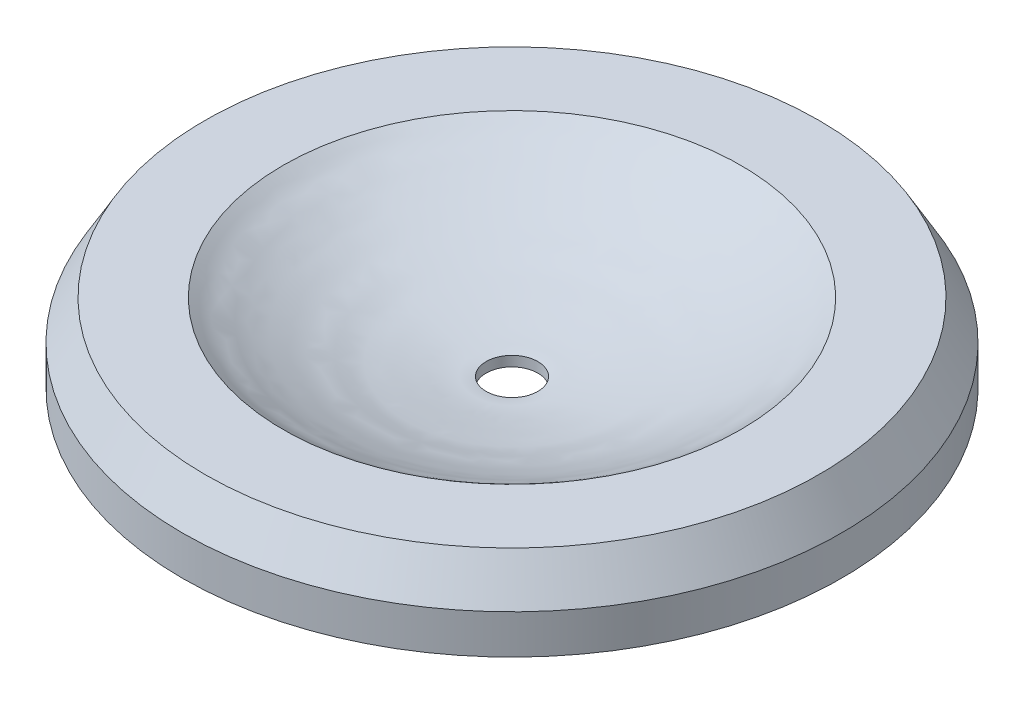
from build123d import *

# Parameters (mm, degrees)
SKETCH1_R           = 42
BOSS_EXTRUDE1_DEPTH = 10
CAVITY1_OUTLINE_W   = 3.296807109
CAVITY1_OUTLINE_H   = 8.722003862
SKETCH2_R           = 3.296807109
CUT_EXTRUDE1_DEPTH  = 61.033934998
CHAMFER1_SIZE       = 5
CHAMFER1_SIZE2      = 2.886751346


# Read off the part's stored shape, not the designer's step: Cavity1
with BuildPart() as part:
    # Sketch1 → Boss-Extrude1 (new body)
    with BuildSketch(Plane(origin=(0, 0, 0), x_dir=(1, 0, 0), z_dir=(0, 1, 0))):
        with Locations(Location((0, 0, 0), (0, 0, 270))):
            Circle(SKETCH1_R)
    extrude(amount=BOSS_EXTRUDE1_DEPTH)

    # Cavity1 outline → Cavity1 (revolve, cut)
    with BuildSketch(Plane.XY):
        with BuildLine():
            Line((3.296807109, 10.0000001), (3.296807109, 1.277996238))
            add(Edge.make_bspline(
                [(3.296807109, 1.277996238), (4.197169621, 1.438365635), (5.69903079, 1.462039555), (7.693496911, 1.848305194), (9.272215478, 2.121674562), (10.750690756, 2.424226191), (12.181632664, 2.720278367), (13.637151846, 2.964975868), (14.864343001, 3.366330129), (15.911496119, 3.711763684), (16.810008215, 4.028877941), (17.733867067, 4.263051977), (18.837916963, 4.636362632), (19.930975123, 5.084503164), (21.068588771, 5.583149701), (22.140955467, 6.015297), (23.215588995, 6.59235717), (24.437095613, 7.161677421), (25.676203543, 7.926154231), (27.106557761, 8.526198992), (28.218828126, 9.339118125), (28.906345613, 9.816936011), (29.169378211, 10)],
                knots=[0, 0, 0, 0, 0.061584864, 0.100794932, 0.136830735, 0.169700167, 0.20256895, 0.235437771, 0.269088288, 0.289472528, 0.309858244, 0.333318894, 0.353706298, 0.388422523, 0.412964695, 0.437513727, 0.466339542, 0.495168076, 0.528353594, 0.564387379, 0.599250153, 0.620877664, 0.620877664, 0.620877664, 0.620877664], degree=3))
            Line((29.169378211, 10), (3.296807109, 10.0000001))
        make_face()
        with Locations((1.648403555, 5.638998169)):
            Rectangle(CAVITY1_OUTLINE_W, CAVITY1_OUTLINE_H)
    revolve(axis=Axis((0, 0, 0), (0, 1, 0)), mode=Mode.SUBTRACT)

    # Sketch2 → Cut-Extrude1 (cut, through all)
    with BuildSketch(Plane(origin=(0, 1.277996238, 0), x_dir=(1, 0, 0), z_dir=(0, 1, 0))):
        with Locations(Location((0, 0, 0), (0, 0, 180))):
            Circle(SKETCH2_R)
    extrude(amount=-CUT_EXTRUDE1_DEPTH, mode=Mode.SUBTRACT)

    # Chamfer1
    chamfer1_edges = [part.edges().sort_by_distance(p)[0] for p in [
        (0, 10, -42),
    ]]
    chamfer1_side = [part.faces().sort_by_distance(p)[0] for p in [
        (0, 5, -42),
    ]]
    chamfer(chamfer1_edges, length=CHAMFER1_SIZE, length2=CHAMFER1_SIZE2, reference=chamfer1_side[0])


solid = part.part
